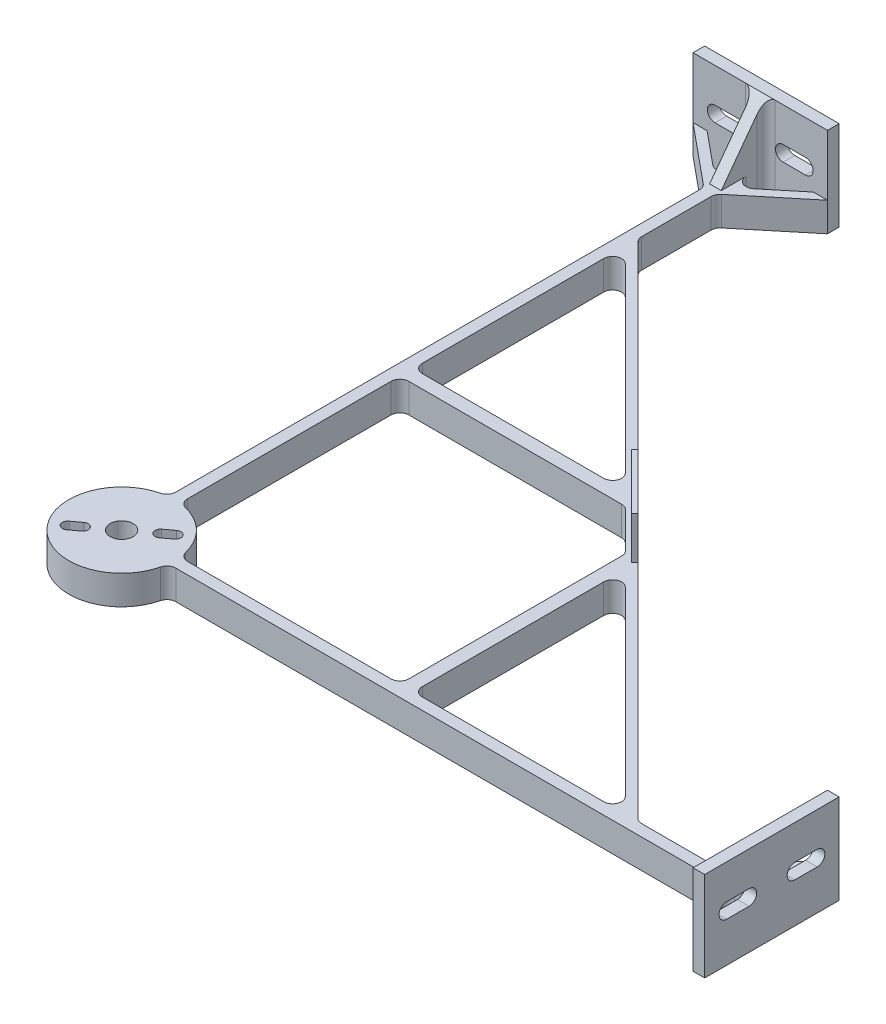
from build123d import *

# Parameters (mm, degrees)
SKETCH1_R           = 3.2385
BOSS_EXTRUDE1_DEPTH = 8.255
SKETCH3_W           = 3.302
SKETCH3_H           = 38.1
SKETCH3_W_2         = 38.1
SKETCH3_H_2         = 3.302
BOSS_EXTRUDE3_DEPTH = 25.4
BOSS_EXTRUDE4_DEPTH = 11.938
CUT_EXTRUDE1_DEPTH  = 276.581279586
SKETCH6_W           = 12.7
SKETCH6_H           = 3.302
BOSS_EXTRUDE5_DEPTH = 25.4
CUT_EXTRUDE2_DEPTH  = 25.4
SKETCH8_W           = 3.302
SKETCH8_H           = 12.7
BOSS_EXTRUDE6_DEPTH = 25.4
CUT_EXTRUDE3_DEPTH  = 25.4
FILLET1_R           = 2.54


with BuildPart() as part:
    # Sketch1 → Boss-Extrude1 (new body)
    with BuildSketch(Plane(origin=(0, 0, 0), x_dir=(1, 0, 0), z_dir=(0, 1, 0))):
        with BuildLine():
            Line((-1.651, 166.628963684), (-1.651, 14.89477744))
            ThreePointArc((-1.651, 14.89477744), (-10.596702223, -10.596702223), (14.89477744, -1.651))
            Line((14.89477744, -1.651), (166.628963684, -1.651))
            Line((166.628963684, -1.651), (180.975, -19.05))
            Line((180.975, -19.05), (180.975, -15.057345133))
            Line((180.975, -15.057345133), (169.921036316, -1.651))
            Line((169.921036316, -1.651), (180.975, -1.651))
            Line((180.975, -1.651), (180.975, 1.651))
            Line((180.975, 1.651), (169.921036316, 1.651))
            Line((169.921036316, 1.651), (180.975, 15.057345133))
            Line((180.975, 15.057345133), (180.975, 19.05))
            Line((180.975, 19.05), (166.628963684, 1.651))
            Line((166.628963684, 1.651), (144.671051224, 1.651))
            Line((144.671051224, 1.651), (1.651, 144.671051224))
            Line((1.651, 144.671051224), (1.651, 166.628963684))
            Line((1.651, 166.628963684), (19.05, 180.975))
            Line((19.05, 180.975), (15.057345133, 180.975))
            Line((15.057345133, 180.975), (1.651, 169.921036316))
            Line((1.651, 169.921036316), (1.651, 180.975))
            Line((1.651, 180.975), (-1.651, 180.975))
            Line((-1.651, 180.975), (-1.651, 169.921036316))
            Line((-1.651, 169.921036316), (-15.057345133, 180.975))
            Line((-15.057345133, 180.975), (-19.05, 180.975))
            Line((-19.05, 180.975), (-1.651, 166.628963684))
        make_face()
        with BuildLine():
            Line((-9.686234559, -5.271576621), (-7.236078848, -3.458556767))
            ThreePointArc((-7.236078848, -3.458556767), (-5.104491065, -3.777124696), (-5.423058993, -5.908712478))
            Line((-5.423058993, -5.908712478), (-7.873214705, -7.721732332))
            ThreePointArc((-7.873214705, -7.721732332), (-10.004802487, -7.403164404), (-9.686234559, -5.271576621))
        make_face(mode=Mode.SUBTRACT)
        Circle(SKETCH1_R, mode=Mode.SUBTRACT)
        with BuildLine():
            ThreePointArc((7.236078848, 3.458556767), (5.104491065, 3.777124696), (5.423058993, 5.908712478))
            Line((5.423058993, 5.908712478), (7.873214705, 7.721732332))
            ThreePointArc((7.873214705, 7.721732332), (10.004802487, 7.403164404), (9.686234559, 5.271576621))
            Line((9.686234559, 5.271576621), (7.236078848, 3.458556767))
        make_face(mode=Mode.SUBTRACT)
        with BuildLine():
            ThreePointArc((14.89477744, 1.651), (10.596702223, 10.596702223), (1.651, 14.89477744))
            Line((1.651, 14.89477744), (1.651, 77.202140867))
            Line((1.651, 77.202140867), (65.527807909, 77.202140867))
            Line((65.527807909, 77.202140867), (77.202140867, 65.527807909))
            Line((77.202140867, 65.527807909), (77.202140867, 1.651))
            Line((77.202140867, 1.651), (14.89477744, 1.651))
        make_face(mode=Mode.SUBTRACT)
        Polygon((141.078948776, 1.651), (81.012140867, 1.651), (81.012140867, 61.717807909), align=None, mode=Mode.SUBTRACT)
        Polygon((1.651, 81.012140867), (1.651, 141.078948776), (61.717807909, 81.012140867), align=None, mode=Mode.SUBTRACT)
    extrude(amount=BOSS_EXTRUDE1_DEPTH)

    # Sketch3 → Boss-Extrude3 (add)
    with BuildSketch(Plane(origin=(0, 0, 0), x_dir=(1, 0, 0), z_dir=(0, 1, 0))):
        with Locations((182.626, 0)):
            Rectangle(SKETCH3_W, SKETCH3_H)
        with Locations((0, 182.626)):
            Rectangle(SKETCH3_W_2, SKETCH3_H_2)
    extrude(amount=BOSS_EXTRUDE3_DEPTH)

    # Sketch4 → Boss-Extrude4 (add)
    with BuildSketch(Plane(origin=(0, 8.255, 0), x_dir=(1, 0, 0), z_dir=(0, 1, 0))):
        Polygon((65.258400226, 81.063650999), (64.360374613, 80.165625387), (80.165625387, 64.360374613), (81.063650999, 65.258400226), align=None)
    extrude(amount=BOSS_EXTRUDE4_DEPTH)

    # Sketch5 → Cut-Extrude1 (cut, through all)
    with BuildSketch(Plane(origin=(184.277, 0, 0), x_dir=(0, 0, -1), z_dir=(1, 0, 0))):
        with BuildLine():
            Line((-12.827, 15.63160537), (-6.477, 15.63160537))
            ThreePointArc((-6.477, 15.63160537), (-4.318, 13.47260537), (-6.477, 11.31360537))
            Line((-6.477, 11.31360537), (-12.827, 11.31360537))
            ThreePointArc((-12.827, 11.31360537), (-14.986, 13.47260537), (-12.827, 15.63160537))
        make_face()
        with BuildLine():
            Line((12.827, 15.63160537), (6.477, 15.63160537))
            ThreePointArc((6.477, 15.63160537), (4.318, 13.47260537), (6.477, 11.31360537))
            Line((6.477, 11.31360537), (12.827, 11.31360537))
            ThreePointArc((12.827, 11.31360537), (14.986, 13.47260537), (12.827, 15.63160537))
        make_face()
    cut_extrude1 = extrude(amount=-CUT_EXTRUDE1_DEPTH, mode=Mode.SUBTRACT)

    # Mirror1: Cut-Extrude1 across plane
    add(cut_extrude1.mirror(Plane(origin=(0, 0, 0), x_dir=(-0.7071067811865585, 0, 0.7071067811865367), z_dir=(0.7071067811865366, 0, 0.7071067811865585))), mode=Mode.SUBTRACT)

    # Sketch6 → Boss-Extrude5 (add)
    with BuildSketch(Plane(origin=(0, 0, 0), x_dir=(1, 0, 0), z_dir=(0, 1, 0))):
        with Locations((174.625, 0)):
            Rectangle(SKETCH6_W, SKETCH6_H)
    extrude(amount=BOSS_EXTRUDE5_DEPTH)

    # Sketch7 → Cut-Extrude2 (cut)
    with BuildSketch(Plane(origin=(0, 0, -1.651), x_dir=(-1, 0, 0), z_dir=(0, 0, -1))):
        Polygon((-180.975, 25.4), (-168.275, 8.255), (-168.275, 25.4), align=None)
    extrude(amount=-CUT_EXTRUDE2_DEPTH, mode=Mode.SUBTRACT)

    # Sketch8 → Boss-Extrude6 (add)
    with BuildSketch(Plane(origin=(0, 0, 0), x_dir=(1, 0, 0), z_dir=(0, 1, 0))):
        with Locations((0, 174.625)):
            Rectangle(SKETCH8_W, SKETCH8_H)
    extrude(amount=BOSS_EXTRUDE6_DEPTH)

    # Sketch9 → Cut-Extrude3 (cut)
    with BuildSketch(Plane(origin=(1.651, 0, 0), x_dir=(0, 0, -1), z_dir=(1, 0, 0))):
        Polygon((180.975, 25.4), (168.275, 8.255), (168.275, 25.4), align=None)
    extrude(amount=-CUT_EXTRUDE3_DEPTH, mode=Mode.SUBTRACT)

    # Fillet1
    fillet1_edges = [part.edges().sort_by_distance(p)[0] for p in [
        (180.975, 12.7, 1.651),
        (-1.651, 12.7, -180.975),
        (141.078948776, 4.1275, -1.651),
        (61.717807909, 4.1275, -81.012140867),
        (1.651, 4.1275, -141.078948776),
        (81.012140867, 4.1275, -61.717807909),
        (14.89477744, 4.1275, 1.651),
        (-1.651, 4.1275, -14.89477744),
        (180.975, 12.7, -1.651),
        (77.202140867, 4.1275, -1.651),
        (1.651, 12.7, -180.975),
        (1.651, 4.1275, -77.202140867),
        (166.628963684, 4.1275, 1.651),
        (65.527807909, 4.1275, -77.202140867),
        (-1.651, 4.1275, -166.628963684),
        (77.202140867, 4.1275, -65.527807909),
        (1.651, 4.1275, -166.628963684),
        (1.651, 4.1275, -14.89477744),
        (1.651, 4.1275, -144.671051224),
        (1.651, 4.1275, -81.012140867),
        (81.012140867, 4.1275, -1.651),
        (166.628963684, 4.1275, -1.651),
        (14.89477744, 4.1275, -1.651),
        (144.671051224, 4.1275, -1.651),
        (-1.651, 4.1275, -169.921036316),
        (1.651, 4.1275, -169.921036316),
        (169.921036316, 4.1275, 1.651),
        (169.921036316, 4.1275, -1.651),
    ]]
    fillet(fillet1_edges, radius=FILLET1_R)


solid = part.part
